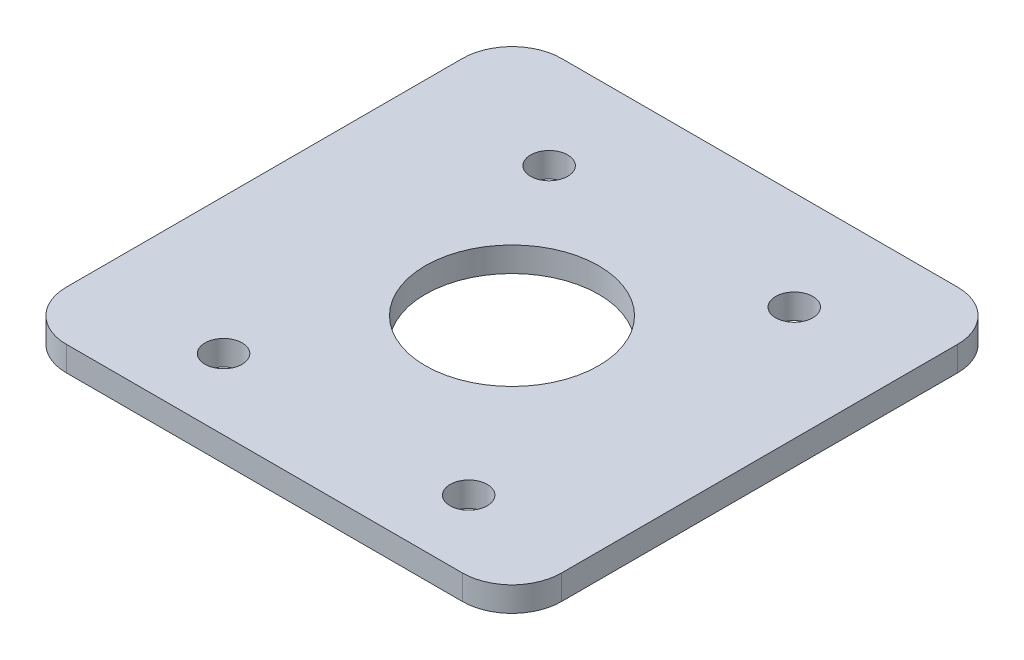
from build123d import *

# Parameters (mm, degrees)
SKETCH2_W           = 40
SKETCH2_H           = 40
SKETCH2_R           = 7
SKETCH2_R_2         = 1.5
BOSS_EXTRUDE1_DEPTH = 2
FILLET1_R           = 4


with BuildPart() as part:
    # Sketch2 → Boss-Extrude1 (new body)
    with BuildSketch(Plane(origin=(0, 0, 0), x_dir=(1, 0, 0), z_dir=(0, 1, 0))):
        Rectangle(SKETCH2_W, SKETCH2_H)
        Circle(SKETCH2_R, mode=Mode.SUBTRACT)
        with Locations((-9, 12)):
            Circle(SKETCH2_R_2, mode=Mode.SUBTRACT)
        with Locations((-9, -14.3)):
            Circle(SKETCH2_R_2, mode=Mode.SUBTRACT)
        with Locations((10.8, -14.3)):
            Circle(SKETCH2_R_2, mode=Mode.SUBTRACT)
        with Locations((10.8, 12)):
            Circle(SKETCH2_R_2, mode=Mode.SUBTRACT)
    extrude(amount=BOSS_EXTRUDE1_DEPTH)

    # Fillet1
    fillet1_edges = [part.edges().sort_by_distance(p)[0] for p in [
        (-20, 1, 20),
        (20, 1, 20),
        (20, 1, -20),
        (-20, 1, -20),
    ]]
    fillet(fillet1_edges, radius=FILLET1_R)


solid = part.part
